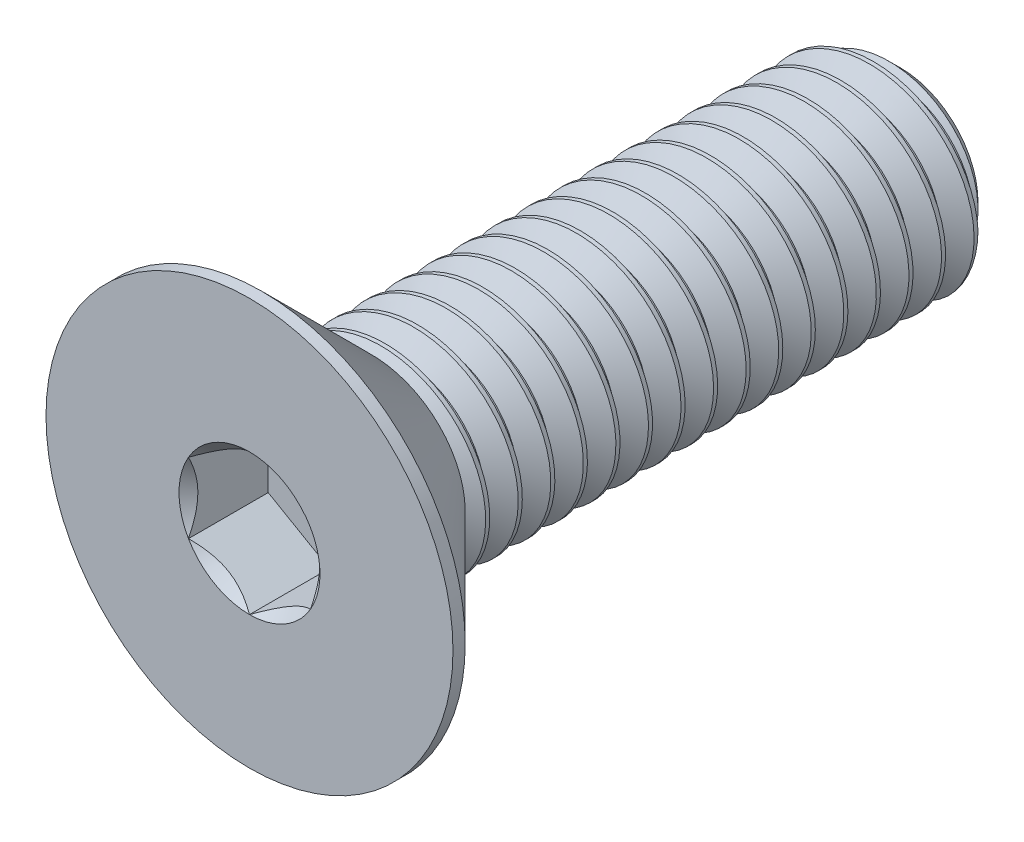
from build123d import *
from build123d.topology import SkipClean

# Parameters (mm, degrees)
SKETCH1_W          = 16
SKETCH1_H          = 2.5
CHAMFER1_SIZE      = 0.6
CUT_SWEEP1_PITCH   = 0.8
CUT_EXTRUDE2_DEPTH = 1.96


with BuildPart() as part:
    # Sketch1 → Revolve1 (revolve)
    with BuildSketch(Plane(origin=(0, 0, 0), x_dir=(0, 0, -1), z_dir=(1, 0, 0))):
        with Locations((8, 1.25)):
            Rectangle(SKETCH1_W, SKETCH1_H)
    revolve(axis=Axis((0, 0, -16), (0, 0, 1)))

    # Chamfer1
    chamfer1_edges = [part.edges().sort_by_distance(p)[0] for p in [
        (0, -2.5, -16),
    ]]
    chamfer(chamfer1_edges, length=CHAMFER1_SIZE)

    # Cut-Sweep1: arcs per turn and ends read off the stored shape
    # Cut-Sweep1: the profile of Sketch2 profile screwed along a right-hand helix through 21 turns, 8 arcs to a turn; built about Z, then put on its axis
    cut_sweep1_z = Axis((0, 0, 0), (0, 0, 1))
    cut_sweep1_corners = [(2.5003, 0, 0.000173205), (2.5003, 0, -0.700173205), (1.980384758, 0, -0.4), (1.980384758, 0, -0.3)]
    with BuildLine(mode=Mode.PRIVATE) as cut_sweep1_profile:
        Line(cut_sweep1_corners[0], cut_sweep1_corners[1])
        Line(cut_sweep1_corners[1], cut_sweep1_corners[2])
        Line(cut_sweep1_corners[2], cut_sweep1_corners[3])
        Line(cut_sweep1_corners[3], cut_sweep1_corners[0])
    cut_sweep1_cap = Face(cut_sweep1_profile.wire())
    cut_sweep1_turn_angles = [0, 22.5, 45, 67.5, 90, 112.5, 135, 157.5, 180, 202.5, 225, 247.5, 270, 292.5, 315, 337.5, 360]
    cut_sweep1_turn_weights = [1, 0.9238795325112867, 1, 0.9238795325112867, 1, 0.9238795325112867, 1, 0.9238795325112867, 1, 0.9238795325112867, 1, 0.9238795325112867, 1, 0.9238795325112867, 1, 0.9238795325112867, 1]
    cut_sweep1_turn_rails = [Edge.make_bspline([Vector(p[0], p[1], 0).rotate(cut_sweep1_z, cut_sweep1_turn_angles[k]) / cut_sweep1_turn_weights[k] + Vector(0, 0, p[2] + CUT_SWEEP1_PITCH * cut_sweep1_turn_angles[k] / 360) for k in range(17)], [0, 0, 0, 1, 1, 2, 2, 3, 3, 4, 4, 5, 5, 6, 6, 7, 7, 8, 8, 8], 2, cut_sweep1_turn_weights) for p in cut_sweep1_corners]
    cut_sweep1_turn_sides = [Face.make_surface_from_curves(cut_sweep1_turn_rails[p[0]], cut_sweep1_turn_rails[p[1]]) for p in [(0, 1), (1, 2), (2, 3), (3, 0)]]
    cut_sweep1 = Plane(origin=(0, 0, -16), x_dir=(0, 1, 0), z_dir=(0, 0, 1)) * Solid(Shell([*[p.moved(Location((0, 0, CUT_SWEEP1_PITCH * i))) for i in range(21) for p in cut_sweep1_turn_sides], cut_sweep1_cap, cut_sweep1_cap.rotate(cut_sweep1_z, 7560).moved(Location((0, 0, CUT_SWEEP1_PITCH * 7560 / 360)))]))
    add(cut_sweep1, mode=Mode.SUBTRACT)

    # Sketch7 → Revolve2 (revolve)
    with BuildSketch(Plane(origin=(0, 0, 0), x_dir=(0, 0, -1), z_dir=(1, 0, 0)), mode=Mode.PRIVATE) as revolve2_sk:
        Polygon((0, 5), (0.3, 5), (2.8, 2.5), (2.8, 0), (0, 0), align=None)
    revolve(revolve2_sk.sketch.rotate(Axis((0, 0, 0), (0, 0, -1)), 180), axis=Axis((0, 0, 0), (0, 0, -1)))

    # Boss-Extrude1 cone 1 section (through the dimple's axis) → Boss-Extrude1 (revolve)
    with SkipClean():  # the faces are left unmerged after this step: merging them gives an invalid solid
        with BuildSketch(Plane(origin=(0, 0, -2.8), x_dir=(0, -1, 0), z_dir=(1, 0, 0))):
            Polygon((0, 0), (2.5, 0), (0, 2.5), align=None)
        revolve(axis=Axis((0, 0, -2.8), (0, 0, -1)))

    # Sketch5 → Cut-Extrude2 (cut)
    with SkipClean():  # the faces are left unmerged after this step: merging them gives an invalid solid
        with BuildSketch(Plane.XY):
            Polygon((1.5, -0.866025404), (1.5, 0.866025404), (0, 1.732050808), (-1.5, 0.866025404), (-1.5, -0.866025404), (0, -1.732050808), align=None)
        extrude(amount=-CUT_EXTRUDE2_DEPTH, mode=Mode.SUBTRACT)

    # Cut-Extrude3 cone 1 section (through the dimple's axis) → Cut-Extrude3 (revolve, cut)
    with SkipClean():  # the faces are left unmerged after this step: merging them gives an invalid solid
        with BuildSketch(Plane(origin=(0, 0, 0), x_dir=(0, -1, 0), z_dir=(1, 0, 0))):
            Polygon((0, 0), (1.732050808, 0), (0, 1.732050808), align=None)
        revolve(axis=Axis((0, 0, 0), (0, 0, -1)), mode=Mode.SUBTRACT)


solid = part.part
